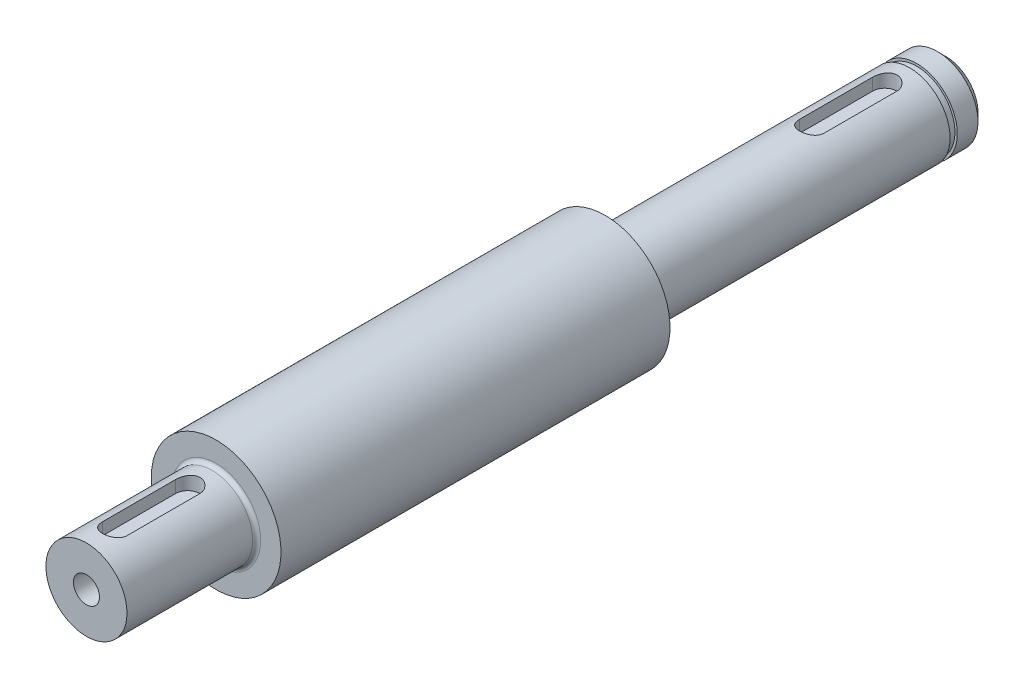
from build123d import *

# Parameters (mm, degrees)
SKETCH1_R                          = 12.7
BOSS_EXTRUDE1_DEPTH                = 38.1
SKETCH3_R                          = 7.9375
BOSS_EXTRUDE2_DEPTH                = 66.675
SKETCH8_R                          = 12.7
SKETCH8_R_2                        = 7.4676
CUT_EXTRUDE1_DEPTH                 = 0.7112
BOSS_EXTRUDE3_START                = 25.4
SKETCH9_R                          = 7.9375
BOSS_EXTRUDE3_DEPTH                = 25.4
FILLET1_R                          = 0.79375
F_1_4_20_TAPPED_HOLE1_D            = 5.1054
F_1_4_20_TAPPED_HOLE1_DEPTH        = 38.1
F_1_4_20_TAPPED_HOLE1_TIP          = 1.533816902
F_3_16_START                       = 5.19049
F_3_16_0_1875_DIAMETER_SLOT1_DEPTH = 3.80951
CHAMFER1_SIZE                      = 1.5875


with BuildPart() as part:
    # Sketch1 → Boss-Extrude1 (new, symmetric)
    with BuildSketch(Plane.XY):
        with Locations(Location((0, 0, 0), (0, 0, 180))):
            Circle(SKETCH1_R)
    extrude(amount=BOSS_EXTRUDE1_DEPTH, both=True)

    # Sketch3 → Boss-Extrude2 (add)
    with BuildSketch(Plane(origin=(0, 0, -38.1), x_dir=(-1, 0, 0), z_dir=(0, 0, -1))):
        with Locations(Location((0, 0, 0), (0, 0, 180))):
            Circle(SKETCH3_R)
    extrude(amount=BOSS_EXTRUDE2_DEPTH)

    # Sketch8 → Cut-Extrude1 (cut, symmetric)
    with BuildSketch(Plane(origin=(0, 0, -98.425), x_dir=(-1, 0, 0), z_dir=(0, 0, -1))):
        Circle(SKETCH8_R)
        Circle(SKETCH8_R_2, mode=Mode.SUBTRACT)
    extrude(amount=CUT_EXTRUDE1_DEPTH, both=True, mode=Mode.SUBTRACT)

    # Sketch9 → Boss-Extrude3 (add)
    with BuildSketch(Plane.XY.offset(38.1).offset(BOSS_EXTRUDE3_START)):
        Circle(SKETCH9_R)
    extrude(amount=-BOSS_EXTRUDE3_DEPTH)

    # Fillet1
    fillet1_edges = [part.edges().sort_by_distance(p)[0] for p in [
        (-7.9375, 0, 38.1),
        (-7.9375, 0, -38.1),
    ]]
    fillet(fillet1_edges, radius=FILLET1_R)

    # 1/4-20 Tapped Hole1
    with Locations(Plane.XY.offset(63.5)):
        with Locations((0, 0)):
            Hole(F_1_4_20_TAPPED_HOLE1_D / 2, depth=F_1_4_20_TAPPED_HOLE1_DEPTH)
            with Locations((0, 0, -(F_1_4_20_TAPPED_HOLE1_DEPTH + F_1_4_20_TAPPED_HOLE1_TIP / 2))):  # 118° drill point
                Cone(0, F_1_4_20_TAPPED_HOLE1_D / 2, F_1_4_20_TAPPED_HOLE1_TIP, mode=Mode.SUBTRACT)

    # 3/16 (0.1875) Diameter Slot1: read off the stored shape, not the designer's step
    # 3/16 (0.1875) Diameter Slot1 outline → 3/16 (0.1875) Diameter Slot1 (cut)
    with BuildSketch(Plane(origin=(0, 0, 0), x_dir=(1, 0, 0), z_dir=(0, 1, 0)).offset(F_3_16_START)):
        with BuildLine():
            ThreePointArc((2.38125, -43.65625), (0, -41.275), (-2.38125, -43.65625))
            Line((-2.38125, -43.65625), (-2.38125, -57.94375))
            ThreePointArc((-2.38125, -57.94375), (0, -60.325), (2.38125, -57.94375))
            Line((2.38125, -57.94375), (2.38125, -43.65625))
        make_face()
        with BuildLine():
            ThreePointArc((2.38125, 92.86875), (0, 95.25), (-2.38125, 92.86875))
            Line((-2.38125, 92.86875), (-2.38125, 78.58125))
            ThreePointArc((-2.38125, 78.58125), (0, 76.2), (2.38125, 78.58125))
            Line((2.38125, 78.58125), (2.38125, 92.86875))
        make_face()
    extrude(amount=F_3_16_0_1875_DIAMETER_SLOT1_DEPTH, mode=Mode.SUBTRACT)

    # Chamfer1
    chamfer1_edges = [part.edges().sort_by_distance(p)[0] for p in [
        (-7.9375, 0, -104.775),
    ]]
    chamfer(chamfer1_edges, length=CHAMFER1_SIZE)


solid = part.part
